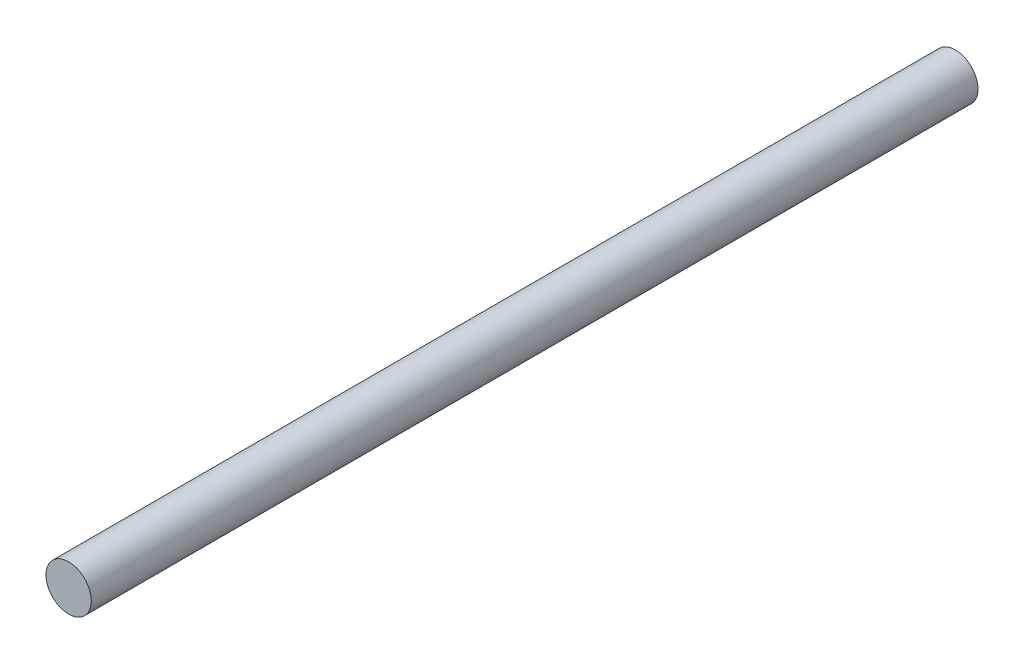
from build123d import *

# Parameters (mm, degrees)
SKETCH1_R           = 5
BOSS_EXTRUDE1_DEPTH = 195.6


with BuildPart() as part:
    # Sketch1 → Boss-Extrude1 (new body)
    with BuildSketch(Plane.XY):
        Circle(SKETCH1_R)
    extrude(amount=BOSS_EXTRUDE1_DEPTH)


solid = part.part
